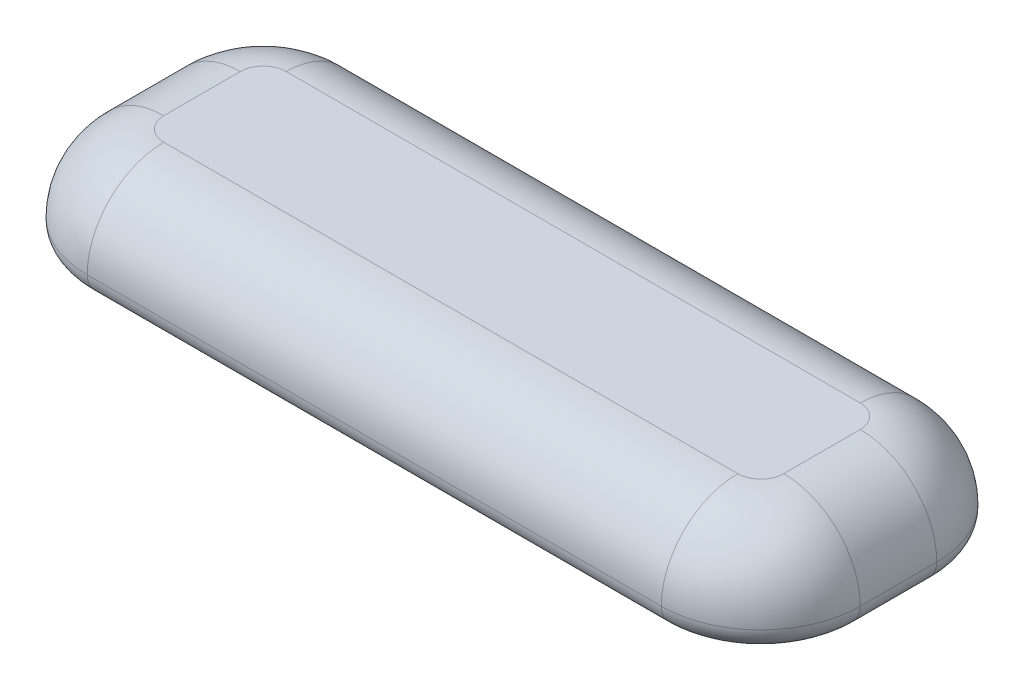
from build123d import *

# Parameters (mm, degrees)
EXTRUDE_1_DEPTH = 10
SHELL_2_T       = 3
FILLET_3_R      = 10
FILLET_4_R      = 3
SKETCH_2_R      = 2.65
EXTRUDE_2_DEPTH = 8
FILLET_7_R      = 5
CHAMFER_1_SIZE  = 0.2
CHAMFER_2_SIZE  = 0.2
FILLET_9_R      = 2
FILLET_10_R     = 2


# Some blends are built 0.0001 mm under size
with BuildPart() as part:
    # 草图1 → 凸台-拉伸1 (new body)
    with BuildSketch(Plane(origin=(0, 0, 0), x_dir=(1, 0, 0), z_dir=(0, 1, 0))):
        with BuildLine():
            Line((-37.5, 15), (37.5, 15))
            ThreePointArc((37.5, 15), (44.571067812, 12.071067812), (47.5, 5))
            Line((47.5, 5), (47.5, -5))
            ThreePointArc((47.5, -5), (44.571067812, -12.071067812), (37.5, -15))
            Line((37.5, -15), (-37.5, -15))
            ThreePointArc((-37.5, -15), (-44.571067812, -12.071067812), (-47.5, -5))
            Line((-47.5, -5), (-47.5, 5))
            ThreePointArc((-47.5, 5), (-44.571067812, 12.071067812), (-37.5, 15))
        make_face()
    extrude(amount=EXTRUDE_1_DEPTH)

    # 抽壳2
    shell_2_openings = [part.faces().sort_by_distance(p)[0] for p in [
        (0, 0, 0),
    ]]
    offset(amount=SHELL_2_T, openings=shell_2_openings, kind=Kind.INTERSECTION)

    # 圆角3
    # the kernel refuses this fillet: 10 mm, written as the material it takes off along each edge
    with BuildSketch(Plane(origin=(37.5, 13, 5), x_dir=(1, 0, 0), z_dir=(0, 0, -1))) as fillet_3_piece_1:
        with BuildLine():
            CenterArc((13 - FILLET_3_R, FILLET_3_R), FILLET_3_R, 270, 90)
            Line((13 - FILLET_3_R, 0), (13, 0))
            Line((13, 0), (13, FILLET_3_R))
        make_face()
    revolve(axis=Axis((37.5, 13, 5), (0, -1, 0)), revolution_arc=90, mode=Mode.SUBTRACT)
    with BuildSketch(Plane(origin=(50.5, 13, 5), x_dir=(0, -1, 0), z_dir=(0, 0, -1)), Plane(origin=(-50.5, 13, -5), x_dir=(0, -1, 0), z_dir=(0, 0, 1))) as fillet_3_piece_2:
        with BuildLine():
            CenterArc((FILLET_3_R, FILLET_3_R), FILLET_3_R, 180, 90)
            Line((0, FILLET_3_R), (0, 0))
            Line((0, 0), (FILLET_3_R, 0))
        make_face()
    extrude(amount=10, mode=Mode.SUBTRACT)
    with BuildSketch(Plane(origin=(37.5, 13, -5), x_dir=(0, 0, -1), z_dir=(-1, 0, 0))) as fillet_3_piece_3:
        with BuildLine():
            CenterArc((13 - FILLET_3_R, FILLET_3_R), FILLET_3_R, 270, 90)
            Line((13 - FILLET_3_R, 0), (13, 0))
            Line((13, 0), (13, FILLET_3_R))
        make_face()
    revolve(axis=Axis((37.5, 13, -5), (0, -1, 0)), revolution_arc=90, mode=Mode.SUBTRACT)
    with BuildSketch(Plane(origin=(37.5, 13, -18), x_dir=(0, -1, 0), z_dir=(-1, 0, 0)), Plane(origin=(-37.5, 13, 18), x_dir=(0, -1, 0), z_dir=(1, 0, 0))) as fillet_3_piece_4:
        with BuildLine():
            CenterArc((FILLET_3_R, FILLET_3_R), FILLET_3_R, 180, 90)
            Line((0, FILLET_3_R), (0, 0))
            Line((0, 0), (FILLET_3_R, 0))
        make_face()
    extrude(amount=75, mode=Mode.SUBTRACT)
    with BuildSketch(Plane(origin=(-37.5, 13, -5), x_dir=(-1, 0, 0), z_dir=(0, 0, 1))) as fillet_3_piece_5:
        with BuildLine():
            CenterArc((13 - FILLET_3_R, FILLET_3_R), FILLET_3_R, 270, 90)
            Line((13 - FILLET_3_R, 0), (13, 0))
            Line((13, 0), (13, FILLET_3_R))
        make_face()
    revolve(axis=Axis((-37.5, 13, -5), (0, -1, 0)), revolution_arc=90, mode=Mode.SUBTRACT)
    with BuildSketch(Plane(origin=(-37.5, 13, 5), x_dir=(0, 0, 1), z_dir=(1, 0, 0))) as fillet_3_piece_6:
        with BuildLine():
            CenterArc((13 - FILLET_3_R, FILLET_3_R), FILLET_3_R, 270, 90)
            Line((13 - FILLET_3_R, 0), (13, 0))
            Line((13, 0), (13, FILLET_3_R))
        make_face()
    revolve(axis=Axis((-37.5, 13, 5), (0, -1, 0)), revolution_arc=90, mode=Mode.SUBTRACT)

    # 圆角4
    fillet_4_edges = [part.edges().sort_by_distance(p)[0] for p in [
        (50.5, 0, 0),
        (46.692388155, 0, 14.192388155),
        (0, 0, 18),
        (-46.692388155, 0, 14.192388155),
        (-50.5, 0, 0),
        (-46.692388155, 0, -14.192388155),
        (0, 0, -18),
        (46.692388155, 0, -14.192388155),
    ]]
    fillet(fillet_4_edges, radius=FILLET_4_R - 0.0001)  # a hair under: the kernel refuses the full size

    # 草图2 → 凸台-拉伸2 (add)
    # profile 1 of 2: a face of its own
    with BuildSketch(Plane(origin=(0, 10, 0), x_dir=(-1, 0, 0), z_dir=(0, -1, 0))):
        with Locations(Location((36.6, 0, 0), (0, 0, 270))):
            Circle(SKETCH_2_R)
        Polygon((34.55, -0.55), (34.55, 0.55), (36.05, 0.55), (36.05, 2.05), (37.15, 2.05), (37.15, 0.55), (38.65, 0.55), (38.65, -0.55), (37.15, -0.55), (37.15, -2.05), (36.05, -2.05), (36.05, -0.55), align=None, mode=Mode.SUBTRACT)
    # profile 2 of 2: a face of its own
    with BuildSketch(Plane(origin=(0, 10, 0), x_dir=(-1, 0, 0), z_dir=(0, -1, 0))):
        with Locations(Location((-36.6, 0, 0), (0, 0, 90))):
            Circle(SKETCH_2_R)
        Polygon((-37.15, 0.55), (-37.15, 2.05), (-36.05, 2.05), (-36.05, 0.55), (-34.55, 0.55), (-34.55, -0.55), (-36.05, -0.55), (-36.05, -2.05), (-37.15, -2.05), (-37.15, -0.55), (-38.65, -0.55), (-38.65, 0.55), align=None, mode=Mode.SUBTRACT)
    extrude(amount=EXTRUDE_2_DEPTH)

    # 圆角7
    fillet_7_edges = [part.edges().sort_by_distance(p)[0] for p in [
        (-44.571067812, 10, 12.071067812),
        (0, 10, 15),
        (44.571067812, 10, 12.071067812),
        (47.5, 10, 0),
        (44.571067812, 10, -12.071067812),
        (0, 10, -15),
        (-44.571067812, 10, -12.071067812),
        (-47.5, 10, 0),
    ]]
    fillet(fillet_7_edges, radius=FILLET_7_R)

    # 倒角1
    chamfer_1_edges = [part.edges().sort_by_distance(p)[0] for p in [
        (35.3, 2, -0.55),
        (37.15, 2, 1.3),
        (38.65, 2, 0),
        (37.9, 2, -0.55),
        (37.15, 2, -1.3),
        (36.6, 2, -2.05),
        (34.55, 2, 0),
        (35.3, 2, 0.55),
        (36.05, 2, 1.3),
        (36.6, 2, 2.05),
        (37.9, 2, 0.55),
        (36.05, 2, -1.3),
    ]]
    chamfer(chamfer_1_edges, length=CHAMFER_1_SIZE)

    # 倒角2
    chamfer_2_edges = [part.edges().sort_by_distance(p)[0] for p in [
        (-36.6, 2, -2.05),
        (-37.15, 2, -1.3),
        (-37.9, 2, -0.55),
        (-38.65, 2, 0),
        (-37.15, 2, 1.3),
        (-35.3, 2, -0.55),
        (-37.9, 2, 0.55),
        (-36.6, 2, 2.05),
        (-36.05, 2, 1.3),
        (-35.3, 2, 0.55),
        (-34.55, 2, 0),
        (-36.05, 2, -1.3),
    ]]
    chamfer(chamfer_2_edges, length=CHAMFER_2_SIZE)

    # 圆角9
    fillet_9_edges = [part.edges().sort_by_distance(p)[0] for p in [
        (36.6, 10, 2.65),
    ]]
    fillet(fillet_9_edges, radius=FILLET_9_R)

    # 圆角10
    fillet_10_edges = [part.edges().sort_by_distance(p)[0] for p in [
        (-36.6, 10, -2.65),
    ]]
    fillet(fillet_10_edges, radius=FILLET_10_R)


solid = part.part
